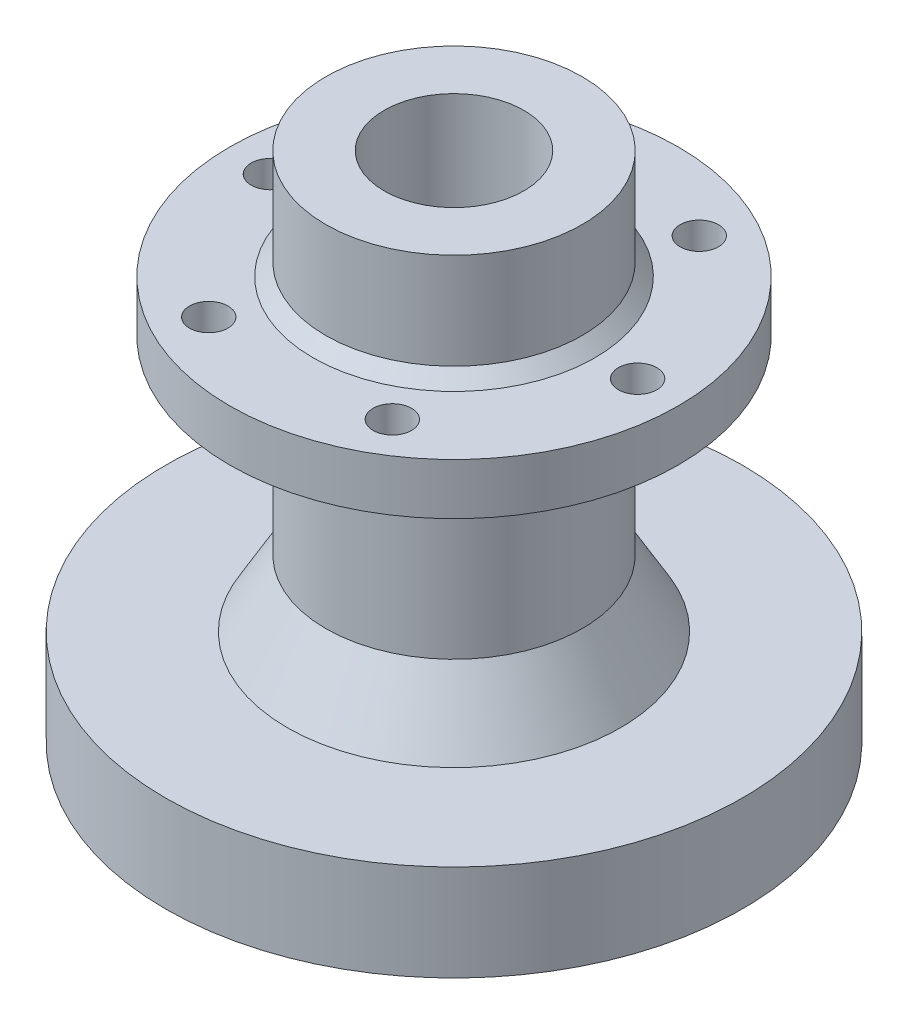
from build123d import *

# Parameters (mm, degrees)
SKETCH_1_R          = 45
EXTRUDE_1_DEPTH     = 15
SKETCH_2_R          = 20
EXTRUDE_2_DEPTH     = 65
SKETCH_4_R          = 10.9
CUT_EXTRUDE_4_DEPTH = 52
EXTRUDE_START       = 8
SKETCH_5_R          = 35
SKETCH_5_R_2        = 10.9
EXTRUDE_5_DEPTH     = 8
CHAMFER_3_SIZE      = 2
CHAMFER_4_SIZE      = 6
CHAMFER_4_SIZE2     = 10.392304845
SKETCH_6_R          = 7
CUT_EXTRUDE_8_DEPTH = 4
CUT_EXTRUDE_1_REACH = 91.549
SKETCH_7_R          = 3


with BuildPart() as part:
    # Эскиз1 → Вытянуть1 (new body)
    with BuildSketch(Plane(origin=(0, 0, 0), x_dir=(1, 0, 0), z_dir=(0, 1, 0))):
        Circle(SKETCH_1_R)
        with BuildLine():
            Line((-2, -6.708203932), (-2, -8.85))
            Line((-2, -8.85), (2.5, -8.85))
            Line((2.5, -8.85), (2.5, -6.538348415))
            ThreePointArc((2.5, -6.538348415), (-0.264031673, 6.995018747), (-2, -6.708203932))
        make_face(mode=Mode.SUBTRACT)
    extrude(amount=EXTRUDE_1_DEPTH)

    # Эскиз2 → Вытянуть2 (add)
    with BuildSketch(Plane(origin=(0, 15, 0), x_dir=(1, 0, 0), z_dir=(0, 1, 0))):
        Circle(SKETCH_2_R)
    extrude(amount=EXTRUDE_2_DEPTH)

    # Эскиз4 → Вытянуть4 (cut)
    with BuildSketch(Plane(origin=(0, 80, 0), x_dir=(1, 0, 0), z_dir=(0, 1, 0))):
        Circle(SKETCH_4_R)
    extrude(amount=-CUT_EXTRUDE_4_DEPTH, mode=Mode.SUBTRACT)

    # Эскиз5 → Вытянуть5 (add)
    with BuildSketch(Plane(origin=(0, 55, 0), x_dir=(-1, 0, 0), z_dir=(0, 1, 0)).offset(EXTRUDE_START)):
        Circle(SKETCH_5_R)
        Circle(SKETCH_5_R_2, mode=Mode.SUBTRACT)
    extrude(amount=-EXTRUDE_5_DEPTH)

    # Фаска3
    chamfer_3_edges = [part.edges().sort_by_distance(p)[0] for p in [
        (-20, 55, 0),
        (-20, 63, 0),
    ]]
    chamfer(chamfer_3_edges, length=CHAMFER_3_SIZE)

    # Фаска4
    chamfer_4_edges = [part.edges().sort_by_distance(p)[0] for p in [
        (-20, 15, 0),
    ]]
    chamfer_4_side = [part.faces().sort_by_distance(p)[0] for p in [
        (-43.727207794, 15, 0),
    ]]
    chamfer(chamfer_4_edges, length=CHAMFER_4_SIZE, length2=CHAMFER_4_SIZE2, reference=chamfer_4_side[0])

    # Эскиз6 → Вытянуть8 (cut)
    with BuildSketch(Plane.XZ.offset(-15)):
        Circle(SKETCH_6_R)
    extrude(amount=-CUT_EXTRUDE_8_DEPTH, mode=Mode.SUBTRACT)

    # Эскиз7 → Вырез-Вытянуть1 (cut, up to next)
    with BuildSketch(Plane(origin=(0, 63, 0), x_dir=(1, 0, 0), z_dir=(0, 1, 0)), mode=Mode.PRIVATE) as cut_extrude_1_sk1:
        with Locations((-28.154160791, -0.499908421)):
            Circle(SKETCH_7_R)
    cut_extrude_1_tool1 = extrude(cut_extrude_1_sk1.sketch, amount=-CUT_EXTRUDE_1_REACH, mode=Mode.PRIVATE) & part.part
    # Эскиз7 → Вырез-Вытянуть1 (cut, up to next)
    with BuildSketch(Plane(origin=(0, 63, 0), x_dir=(1, 0, 0), z_dir=(0, 1, 0)), mode=Mode.PRIVATE) as cut_extrude_1_sk2:
        with Locations((-14.510013788, 24.132264256)):
            Circle(SKETCH_7_R)
    cut_extrude_1_tool2 = extrude(cut_extrude_1_sk2.sketch, amount=-CUT_EXTRUDE_1_REACH, mode=Mode.PRIVATE) & part.part
    # Эскиз7 → Вырез-Вытянуть1 (cut, up to next)
    with BuildSketch(Plane(origin=(0, 63, 0), x_dir=(1, 0, 0), z_dir=(0, 1, 0)), mode=Mode.PRIVATE) as cut_extrude_1_sk3:
        with Locations((13.644147003, 24.632172678)):
            Circle(SKETCH_7_R)
    cut_extrude_1_tool3 = extrude(cut_extrude_1_sk3.sketch, amount=-CUT_EXTRUDE_1_REACH, mode=Mode.PRIVATE) & part.part
    # Эскиз7 → Вырез-Вытянуть1 (cut, up to next)
    with BuildSketch(Plane(origin=(0, 63, 0), x_dir=(1, 0, 0), z_dir=(0, 1, 0)), mode=Mode.PRIVATE) as cut_extrude_1_sk4:
        with Locations((28.154160791, 0.499908421)):
            Circle(SKETCH_7_R)
    cut_extrude_1_tool4 = extrude(cut_extrude_1_sk4.sketch, amount=-CUT_EXTRUDE_1_REACH, mode=Mode.PRIVATE) & part.part
    # Эскиз7 → Вырез-Вытянуть1 (cut, up to next)
    with BuildSketch(Plane(origin=(0, 63, 0), x_dir=(1, 0, 0), z_dir=(0, 1, 0)), mode=Mode.PRIVATE) as cut_extrude_1_sk5:
        with Locations((14.510013788, -24.132264256)):
            Circle(SKETCH_7_R)
    cut_extrude_1_tool5 = extrude(cut_extrude_1_sk5.sketch, amount=-CUT_EXTRUDE_1_REACH, mode=Mode.PRIVATE) & part.part
    # Эскиз7 → Вырез-Вытянуть1 (cut, up to next)
    with BuildSketch(Plane(origin=(0, 63, 0), x_dir=(1, 0, 0), z_dir=(0, 1, 0)), mode=Mode.PRIVATE) as cut_extrude_1_sk6:
        with Locations((-13.644147003, -24.632172678)):
            Circle(SKETCH_7_R)
    cut_extrude_1_tool6 = extrude(cut_extrude_1_sk6.sketch, amount=-CUT_EXTRUDE_1_REACH, mode=Mode.PRIVATE) & part.part
    add(cut_extrude_1_tool1.solids().sort_by_distance((-28.154161, 63, 0.499908))[0], mode=Mode.SUBTRACT)
    add(cut_extrude_1_tool2.solids().sort_by_distance((-14.510014, 63, -24.132264))[0], mode=Mode.SUBTRACT)
    add(cut_extrude_1_tool3.solids().sort_by_distance((13.644147, 63, -24.632173))[0], mode=Mode.SUBTRACT)
    add(cut_extrude_1_tool4.solids().sort_by_distance((28.154161, 63, -0.499908))[0], mode=Mode.SUBTRACT)
    add(cut_extrude_1_tool5.solids().sort_by_distance((14.510014, 63, 24.132264))[0], mode=Mode.SUBTRACT)
    add(cut_extrude_1_tool6.solids().sort_by_distance((-13.644147, 63, 24.632173))[0], mode=Mode.SUBTRACT)


solid = part.part
